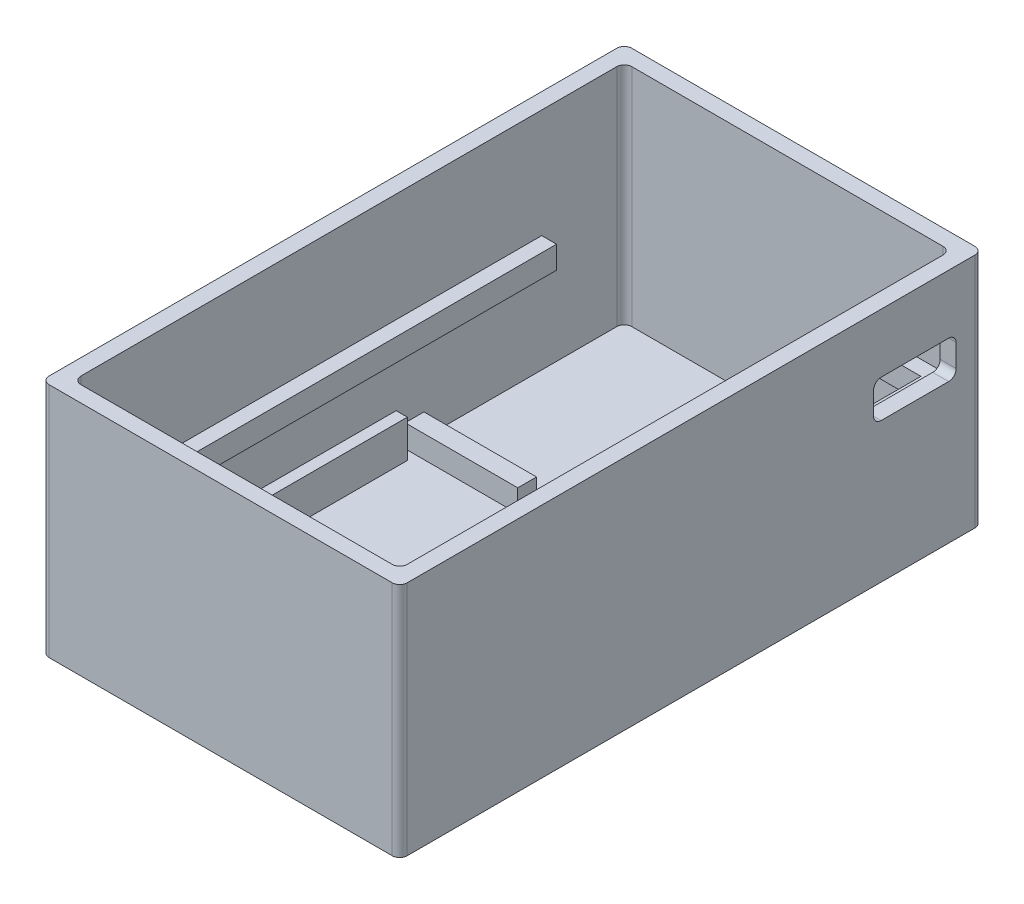
from build123d import *

# Parameters (mm, degrees)
PCB_DIMENSIONS_W    = 47.716732244
PCB_DIMENSIONS_H    = 77.636732244
BOSS_EXTRUDE3_DEPTH = 1.5
SKETCH5_W           = 47.716732244
SKETCH5_H           = 77.636732244
SKETCH5_W_2         = 43.474091557
SKETCH5_H_2         = 73.394091557
BOSS_EXTRUDE5_DEPTH = 30
FILLET1_R           = 1
SKETCH9_W           = 1.93805105
SKETCH9_H           = 42
SKETCH9_W_2         = 1.938051049
BOSS_EXTRUDE6_DEPTH = 5
SKETCH14_W          = 15
SKETCH14_H          = 2.5
BOSS_EXTRUDE7_DEPTH = 3
SKETCH15_W          = 75.636732244
SKETCH15_H          = 3
BOSS_EXTRUDE8_DEPTH = 46
SKETCH17_W          = 39.522771214
SKETCH17_H          = 62.982276128
CUT_EXTRUDE1_DEPTH  = 3
CUT_EXTRUDE2_DEPTH  = 3
SKETCH19_W          = 11
SKETCH19_H          = 5
CUT_EXTRUDE3_DEPTH  = 10
FILLET2_R           = 1
SCALE1_SCALE        = 0.99


with BuildPart() as part:
    # PCB Dimensions → Boss-Extrude3 (new body)
    with BuildSketch(Plane(origin=(0, 0, 0), x_dir=(1, 0, 0), z_dir=(0, 1, 0))):
        with Locations((20.322832216, -35.282832216)):
            Rectangle(PCB_DIMENSIONS_W, PCB_DIMENSIONS_H)
    extrude(amount=BOSS_EXTRUDE3_DEPTH)

    # Sketch5 → Boss-Extrude5 (add)
    with BuildSketch(Plane(origin=(0, 1.5, 0), x_dir=(1, 0, 0), z_dir=(0, 1, 0))):
        with Locations((20.322832216, -35.282832216)):
            Rectangle(SKETCH5_W, SKETCH5_H)
        with Locations((20.322832217, -35.282832217)):
            Rectangle(SKETCH5_W_2, SKETCH5_H_2, mode=Mode.SUBTRACT)
    extrude(amount=BOSS_EXTRUDE5_DEPTH)

    # Fillet1
    fillet1_edges = [part.edges().sort_by_distance(p)[0] for p in [
        (42.059877995, 16.5, 71.979877995),
        (-3.535533906, 15.75, 74.101198338),
        (44.181198338, 15.75, 74.101198338),
        (44.181198338, 15.75, -3.535533906),
        (-3.535533906, 15.75, -3.535533906),
        (-1.414213562, 16.5, 71.979877995),
        (42.059877995, 16.5, -1.414213562),
        (-1.414213562, 16.5, -1.414213562),
    ]]
    fillet(fillet1_edges, radius=FILLET1_R)

    # Sketch9 → Boss-Extrude6 (add)
    with BuildSketch(Plane(origin=(0, 1.5, 0), x_dir=(1, 0, 0), z_dir=(0, 1, 0))):
        with Locations((-0.88911969, -49.979881394)):
            Rectangle(SKETCH9_W, SKETCH9_H)
        with Locations((41.534784122, -49.979881394)):
            Rectangle(SKETCH9_W_2, SKETCH9_H)
    extrude(amount=BOSS_EXTRUDE6_DEPTH)

    # Sketch14 → Boss-Extrude7 (add)
    with BuildSketch(Plane(origin=(0, 1.5, 0), x_dir=(1, 0, 0), z_dir=(0, 1, 0))):
        with Locations((6.085786438, -26.529881394)):
            Rectangle(SKETCH14_W, SKETCH14_H)
        with Locations((34.559877995, -26.529881394)):
            Rectangle(SKETCH14_W, SKETCH14_H)
    extrude(amount=BOSS_EXTRUDE7_DEPTH)

    # Sketch15 → Boss-Extrude8 (add)
    with BuildSketch(Plane(origin=(44.181198338, 0, 0), x_dir=(0, 0, -1), z_dir=(1, 0, 0))):
        with Locations((-35.282832216, 15.5)):
            Rectangle(SKETCH15_W, SKETCH15_H)
    extrude(amount=-BOSS_EXTRUDE8_DEPTH)

    # Sketch17 → Cut-Extrude1 (cut)
    with BuildSketch(Plane(origin=(0, 17, 0), x_dir=(1, 0, 0), z_dir=(0, 1, 0))):
        with Locations((20.322832216, -32.052584673)):
            Rectangle(SKETCH17_W, SKETCH17_H)
    extrude(amount=-CUT_EXTRUDE1_DEPTH, mode=Mode.SUBTRACT)

    # Sketch18 → Cut-Extrude2 (cut)
    with BuildSketch(Plane(origin=(0, 17, 0), x_dir=(1, 0, 0), z_dir=(0, 1, 0))):
        with BuildLine():
            Line((-1.414213562, -9.585786438), (28.585786438, -9.585786438))
            Line((28.585786438, -9.585786438), (28.585786438, 1.414213562))
            Line((28.585786438, 1.414213562), (-0.414213562, 1.414213562))
            ThreePointArc((-0.414213562, 1.414213562), (-1.121320344, 1.121320344), (-1.414213562, 0.414213562))
            Line((-1.414213562, 0.414213562), (-1.414213562, -9.585786438))
        make_face()
    extrude(amount=-CUT_EXTRUDE2_DEPTH, mode=Mode.SUBTRACT)

    # Sketch19 → Cut-Extrude3 (cut)
    with BuildSketch(Plane(origin=(44.181198338, 0, 0), x_dir=(0, 0, -1), z_dir=(1, 0, 0))):
        with Locations((-5.464466094, 21.15)):
            Rectangle(SKETCH19_W, SKETCH19_H)
    extrude(amount=-CUT_EXTRUDE3_DEPTH, mode=Mode.SUBTRACT)

    # Fillet2
    fillet2_edges = [part.edges().sort_by_distance(p)[0] for p in [
        (43.120538167, 18.65, 10.964466094),
        (43.120538167, 18.65, -0.035533906),
        (43.120538167, 23.65, -0.035533906),
        (43.120538167, 23.65, 10.964466094),
    ]]
    fillet(fillet2_edges, radius=FILLET2_R)


with BuildPart() as part_1:
    # Scale1: scaled about (20.30907108, 12.22563111, 37.095530551)
    add(part.part.scale(SCALE1_SCALE).moved(Location((0.203090711, 0.122256311, 0.370955306))))


solid = part_1.part
